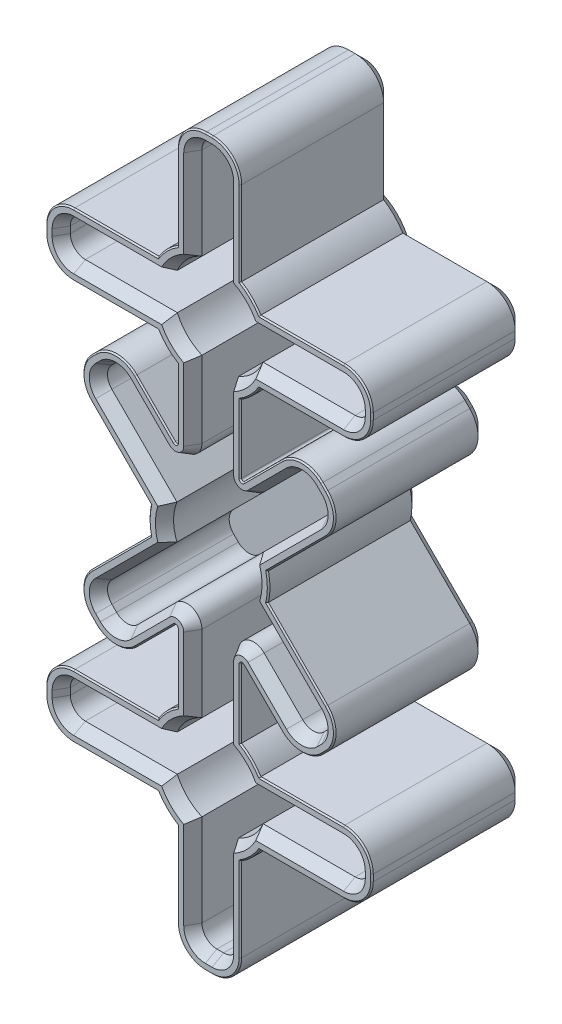
from build123d import *

# Parameters (mm, degrees)
WALLS_DEPTH       = 20
TOP_START         = -3
TOP_PLATE_DEPTH   = 3
CHAMFER1_SIZE     = 1.5
INSERT_CHAM_SIZE  = 1
INSERT_CHAM_SIZE2 = 1.732050808
DEBURS_SIZE       = 0.2


with BuildPart() as part:
    # Sketch5 → Walls (new body)
    with BuildSketch(Plane.XY):
        with BuildLine():
            Line((4.75, 37.644442426), (4.75, 50.25))
            ThreePointArc((4.75, 50.25), (3.50520382, 53.25520382), (0.5, 54.5))
            Line((0.5, 54.5), (-0.5, 54.5))
            ThreePointArc((-0.5, 54.5), (-3.50520382, 53.25520382), (-4.75, 50.25))
            Line((-4.75, 50.25), (-4.75, 37.644442426))
            ThreePointArc((-4.75, 37.644442426), (-6.363961031, 36.363961031), (-7.644442426, 34.75))
            Line((-7.644442426, 34.75), (-20.25, 34.75))
            ThreePointArc((-20.25, 34.75), (-23.25520382, 33.50520382), (-24.5, 30.5))
            Line((-24.5, 30.5), (-24.5, 29.5))
            ThreePointArc((-24.5, 29.5), (-23.25520382, 26.49479618), (-20.25, 25.25))
            Line((-20.25, 25.25), (-7.644442426, 25.25))
            ThreePointArc((-7.644442426, 25.25), (-6.363961031, 23.636038969), (-4.75, 22.355557574))
            Line((-4.75, 22.355557574), (-4.75, 12.071067812))
            ThreePointArc((-4.75, 12.071067812), (-4.904329142, 11.840097929), (-5.176776695, 11.894291117))
            Line((-5.176776695, 11.894291117), (-10.960155108, 17.67766953))
            ThreePointArc((-10.960155108, 17.67766953), (-13.965358928, 18.92246571), (-16.970562748, 17.67766953))
            Line((-16.970562748, 17.67766953), (-17.67766953, 16.970562748))
            ThreePointArc((-17.67766953, 16.970562748), (-18.92246571, 13.965358928), (-17.67766953, 10.960155108))
            Line((-17.67766953, 10.960155108), (-8.764194288, 2.046679867))
            ThreePointArc((-8.764194288, 2.046679867), (-9, 0), (-8.764194288, -2.046679867))
            Line((-8.764194288, -2.046679867), (-17.67766953, -10.960155108))
            ThreePointArc((-17.67766953, -10.960155108), (-18.92246571, -13.965358928), (-17.67766953, -16.970562748))
            Line((-17.67766953, -16.970562748), (-16.970562748, -17.67766953))
            ThreePointArc((-16.970562748, -17.67766953), (-13.965358928, -18.92246571), (-10.960155108, -17.67766953))
            Line((-10.960155108, -17.67766953), (-5.176776695, -11.894291117))
            ThreePointArc((-5.176776695, -11.894291117), (-4.904329142, -11.840097929), (-4.75, -12.071067812))
            Line((-4.75, -12.071067812), (-4.75, -22.355557574))
            ThreePointArc((-4.75, -22.355557574), (-6.363961031, -23.636038969), (-7.644442426, -25.25))
            Line((-7.644442426, -25.25), (-20.25, -25.25))
            ThreePointArc((-20.25, -25.25), (-23.25520382, -26.49479618), (-24.5, -29.5))
            Line((-24.5, -29.5), (-24.5, -30.5))
            ThreePointArc((-24.5, -30.5), (-23.25520382, -33.50520382), (-20.25, -34.75))
            Line((-20.25, -34.75), (-7.644442426, -34.75))
            ThreePointArc((-7.644442426, -34.75), (-6.363961031, -36.363961031), (-4.75, -37.644442426))
            Line((-4.75, -37.644442426), (-4.75, -50.25))
            ThreePointArc((-4.75, -50.25), (-3.50520382, -53.25520382), (-0.5, -54.5))
            Line((-0.5, -54.5), (0.5, -54.5))
            ThreePointArc((0.5, -54.5), (3.50520382, -53.25520382), (4.75, -50.25))
            Line((4.75, -50.25), (4.75, -37.644442426))
            ThreePointArc((4.75, -37.644442426), (6.363961031, -36.363961031), (7.644442426, -34.75))
            Line((7.644442426, -34.75), (20.25, -34.75))
            ThreePointArc((20.25, -34.75), (23.25520382, -33.50520382), (24.5, -30.5))
            Line((24.5, -30.5), (24.5, -29.5))
            ThreePointArc((24.5, -29.5), (23.25520382, -26.49479618), (20.25, -25.25))
            Line((20.25, -25.25), (7.644442426, -25.25))
            ThreePointArc((7.644442426, -25.25), (6.363961031, -23.636038969), (4.75, -22.355557574))
            Line((4.75, -22.355557574), (4.75, -12.071067812))
            ThreePointArc((4.75, -12.071067812), (4.904329142, -11.840097929), (5.176776695, -11.894291117))
            Line((5.176776695, -11.894291117), (10.960155108, -17.67766953))
            ThreePointArc((10.960155108, -17.67766953), (13.965358928, -18.92246571), (16.970562748, -17.67766953))
            Line((16.970562748, -17.67766953), (17.67766953, -16.970562748))
            ThreePointArc((17.67766953, -16.970562748), (18.92246571, -13.965358928), (17.67766953, -10.960155108))
            Line((17.67766953, -10.960155108), (8.764194288, -2.046679867))
            ThreePointArc((8.764194288, -2.046679867), (9, 0), (8.764194288, 2.046679867))
            Line((8.764194288, 2.046679867), (17.67766953, 10.960155108))
            ThreePointArc((17.67766953, 10.960155108), (18.92246571, 13.965358928), (17.67766953, 16.970562748))
            Line((17.67766953, 16.970562748), (16.970562748, 17.67766953))
            ThreePointArc((16.970562748, 17.67766953), (13.965358928, 18.92246571), (10.960155108, 17.67766953))
            Line((10.960155108, 17.67766953), (5.176776695, 11.894291117))
            ThreePointArc((5.176776695, 11.894291117), (4.904329142, 11.840097929), (4.75, 12.071067812))
            Line((4.75, 12.071067812), (4.75, 22.355557574))
            ThreePointArc((4.75, 22.355557574), (6.363961031, 23.636038969), (7.644442426, 25.25))
            Line((7.644442426, 25.25), (20.25, 25.25))
            ThreePointArc((20.25, 25.25), (23.25520382, 26.49479618), (24.5, 29.5))
            Line((24.5, 29.5), (24.5, 30.5))
            ThreePointArc((24.5, 30.5), (23.25520382, 33.50520382), (20.25, 34.75))
            Line((20.25, 34.75), (7.644442426, 34.75))
            ThreePointArc((7.644442426, 34.75), (6.363961031, 36.363961031), (4.75, 37.644442426))
        make_face()
        with BuildLine():
            Line((2.75, 36.437196595), (2.75, 50.25))
            ThreePointArc((2.75, 50.25), (2.090990258, 51.840990258), (0.5, 52.5))
            Line((0.5, 52.5), (-0.5, 52.5))
            ThreePointArc((-0.5, 52.5), (-2.090990258, 51.840990258), (-2.75, 50.25))
            Line((-2.75, 50.25), (-2.75, 36.437196595))
            ThreePointArc((-2.75, 36.437196595), (-4.949747468, 34.949747468), (-6.437196595, 32.75))
            Line((-6.437196595, 32.75), (-20.25, 32.75))
            ThreePointArc((-20.25, 32.75), (-21.840990258, 32.090990258), (-22.5, 30.5))
            Line((-22.5, 30.5), (-22.5, 29.5))
            ThreePointArc((-22.5, 29.5), (-21.840990258, 27.909009742), (-20.25, 27.25))
            Line((-20.25, 27.25), (-6.437196595, 27.25))
            ThreePointArc((-6.437196595, 27.25), (-4.949747468, 25.050252532), (-2.75, 23.562803405))
            Line((-2.75, 23.562803405), (-2.75, 12.071067812))
            ThreePointArc((-2.75, 12.071067812), (-4.138962277, 9.992338864), (-6.590990258, 10.480077554))
            Line((-6.590990258, 10.480077554), (-12.374368671, 16.263455967))
            ThreePointArc((-12.374368671, 16.263455967), (-13.965358928, 16.92246571), (-15.556349186, 16.263455967))
            Line((-15.556349186, 16.263455967), (-16.263455967, 15.556349186))
            ThreePointArc((-16.263455967, 15.556349186), (-16.92246571, 13.965358928), (-16.263455967, 12.374368671))
            Line((-16.263455967, 12.374368671), (-6.496329012, 2.607241716))
            ThreePointArc((-6.496329012, 2.607241716), (-7, 0), (-6.496329012, -2.607241716))
            Line((-6.496329012, -2.607241716), (-16.263455967, -12.374368671))
            ThreePointArc((-16.263455967, -12.374368671), (-16.92246571, -13.965358928), (-16.263455967, -15.556349186))
            Line((-16.263455967, -15.556349186), (-15.556349186, -16.263455967))
            ThreePointArc((-15.556349186, -16.263455967), (-13.965358928, -16.92246571), (-12.374368671, -16.263455967))
            Line((-12.374368671, -16.263455967), (-6.590990258, -10.480077554))
            ThreePointArc((-6.590990258, -10.480077554), (-4.138962277, -9.992338864), (-2.75, -12.071067812))
            Line((-2.75, -12.071067812), (-2.75, -23.562803405))
            ThreePointArc((-2.75, -23.562803405), (-4.949747468, -25.050252532), (-6.437196595, -27.25))
            Line((-6.437196595, -27.25), (-20.25, -27.25))
            ThreePointArc((-20.25, -27.25), (-21.840990258, -27.909009742), (-22.5, -29.5))
            Line((-22.5, -29.5), (-22.5, -30.5))
            ThreePointArc((-22.5, -30.5), (-21.840990258, -32.090990258), (-20.25, -32.75))
            Line((-20.25, -32.75), (-6.437196595, -32.75))
            ThreePointArc((-6.437196595, -32.75), (-4.949747468, -34.949747468), (-2.75, -36.437196595))
            Line((-2.75, -36.437196595), (-2.75, -50.25))
            ThreePointArc((-2.75, -50.25), (-2.090990258, -51.840990258), (-0.5, -52.5))
            Line((-0.5, -52.5), (0.5, -52.5))
            ThreePointArc((0.5, -52.5), (2.090990258, -51.840990258), (2.75, -50.25))
            Line((2.75, -50.25), (2.75, -36.437196595))
            ThreePointArc((2.75, -36.437196595), (4.949747468, -34.949747468), (6.437196595, -32.75))
            Line((6.437196595, -32.75), (20.25, -32.75))
            ThreePointArc((20.25, -32.75), (21.840990258, -32.090990258), (22.5, -30.5))
            Line((22.5, -30.5), (22.5, -29.5))
            ThreePointArc((22.5, -29.5), (21.840990258, -27.909009742), (20.25, -27.25))
            Line((20.25, -27.25), (6.437196595, -27.25))
            ThreePointArc((6.437196595, -27.25), (4.949747468, -25.050252532), (2.75, -23.562803405))
            Line((2.75, -23.562803405), (2.75, -12.071067812))
            ThreePointArc((2.75, -12.071067812), (4.138962277, -9.992338864), (6.590990258, -10.480077554))
            Line((6.590990258, -10.480077554), (12.374368671, -16.263455967))
            ThreePointArc((12.374368671, -16.263455967), (13.965358928, -16.92246571), (15.556349186, -16.263455967))
            Line((15.556349186, -16.263455967), (16.263455967, -15.556349186))
            ThreePointArc((16.263455967, -15.556349186), (16.92246571, -13.965358928), (16.263455967, -12.374368671))
            Line((16.263455967, -12.374368671), (6.496329012, -2.607241716))
            ThreePointArc((6.496329012, -2.607241716), (7, 0), (6.496329012, 2.607241716))
            Line((6.496329012, 2.607241716), (16.263455967, 12.374368671))
            ThreePointArc((16.263455967, 12.374368671), (16.92246571, 13.965358928), (16.263455967, 15.556349186))
            Line((16.263455967, 15.556349186), (15.556349186, 16.263455967))
            ThreePointArc((15.556349186, 16.263455967), (13.965358928, 16.92246571), (12.374368671, 16.263455967))
            Line((12.374368671, 16.263455967), (6.590990258, 10.480077554))
            ThreePointArc((6.590990258, 10.480077554), (4.138962277, 9.992338864), (2.75, 12.071067812))
            Line((2.75, 12.071067812), (2.75, 23.562803405))
            ThreePointArc((2.75, 23.562803405), (4.949747468, 25.050252532), (6.437196595, 27.25))
            Line((6.437196595, 27.25), (20.25, 27.25))
            ThreePointArc((20.25, 27.25), (21.840990258, 27.909009742), (22.5, 29.5))
            Line((22.5, 29.5), (22.5, 30.5))
            ThreePointArc((22.5, 30.5), (21.840990258, 32.090990258), (20.25, 32.75))
            Line((20.25, 32.75), (6.437196595, 32.75))
            ThreePointArc((6.437196595, 32.75), (4.949747468, 34.949747468), (2.75, 36.437196595))
        make_face(mode=Mode.SUBTRACT)
    extrude(amount=WALLS_DEPTH)

    # Sketch6 → Top Plate (add)
    with BuildSketch(Plane.XY.offset(TOP_START)):
        with BuildLine():
            Line((8.764194288, 2.046679867), (17.67766953, 10.960155108))
            ThreePointArc((17.67766953, 10.960155108), (18.92246571, 13.965358928), (17.67766953, 16.970562748))
            Line((17.67766953, 16.970562748), (16.970562748, 17.67766953))
            ThreePointArc((16.970562748, 17.67766953), (13.965358928, 18.92246571), (10.960155108, 17.67766953))
            Line((10.960155108, 17.67766953), (5.176776695, 11.894291117))
            ThreePointArc((5.176776695, 11.894291117), (4.904329142, 11.840097929), (4.75, 12.071067812))
            Line((4.75, 12.071067812), (4.75, 22.355557574))
            ThreePointArc((4.75, 22.355557574), (6.363961031, 23.636038969), (7.644442426, 25.25))
            Line((7.644442426, 25.25), (20.25, 25.25))
            ThreePointArc((20.25, 25.25), (23.25520382, 26.49479618), (24.5, 29.5))
            Line((24.5, 29.5), (24.5, 30.5))
            ThreePointArc((24.5, 30.5), (23.25520382, 33.50520382), (20.25, 34.75))
            Line((20.25, 34.75), (7.644442426, 34.75))
            ThreePointArc((7.644442426, 34.75), (6.363961031, 36.363961031), (4.75, 37.644442426))
            Line((4.75, 37.644442426), (4.75, 50.25))
            ThreePointArc((4.75, 50.25), (3.50520382, 53.25520382), (0.5, 54.5))
            Line((0.5, 54.5), (-0.5, 54.5))
            ThreePointArc((-0.5, 54.5), (-3.50520382, 53.25520382), (-4.75, 50.25))
            Line((-4.75, 50.25), (-4.75, 37.644442426))
            ThreePointArc((-4.75, 37.644442426), (-6.363961031, 36.363961031), (-7.644442426, 34.75))
            Line((-7.644442426, 34.75), (-20.25, 34.75))
            ThreePointArc((-20.25, 34.75), (-23.25520382, 33.50520382), (-24.5, 30.5))
            Line((-24.5, 30.5), (-24.5, 29.5))
            ThreePointArc((-24.5, 29.5), (-23.25520382, 26.49479618), (-20.25, 25.25))
            Line((-20.25, 25.25), (-7.644442426, 25.25))
            ThreePointArc((-7.644442426, 25.25), (-6.363961031, 23.636038969), (-4.75, 22.355557574))
            Line((-4.75, 22.355557574), (-4.75, 12.071067812))
            ThreePointArc((-4.75, 12.071067812), (-4.904329142, 11.840097929), (-5.176776695, 11.894291117))
            Line((-5.176776695, 11.894291117), (-10.960155108, 17.67766953))
            ThreePointArc((-10.960155108, 17.67766953), (-13.965358928, 18.92246571), (-16.970562748, 17.67766953))
            Line((-16.970562748, 17.67766953), (-17.67766953, 16.970562748))
            ThreePointArc((-17.67766953, 16.970562748), (-18.92246571, 13.965358928), (-17.67766953, 10.960155108))
            Line((-17.67766953, 10.960155108), (-8.764194288, 2.046679867))
            ThreePointArc((-8.764194288, 2.046679867), (-9, 0), (-8.764194288, -2.046679867))
            Line((-8.764194288, -2.046679867), (-17.67766953, -10.960155108))
            ThreePointArc((-17.67766953, -10.960155108), (-18.92246571, -13.965358928), (-17.67766953, -16.970562748))
            Line((-17.67766953, -16.970562748), (-16.970562748, -17.67766953))
            ThreePointArc((-16.970562748, -17.67766953), (-13.965358928, -18.92246571), (-10.960155108, -17.67766953))
            Line((-10.960155108, -17.67766953), (-5.176776695, -11.894291117))
            ThreePointArc((-5.176776695, -11.894291117), (-4.904329142, -11.840097929), (-4.75, -12.071067812))
            Line((-4.75, -12.071067812), (-4.75, -22.355557574))
            ThreePointArc((-4.75, -22.355557574), (-6.363961031, -23.636038969), (-7.644442426, -25.25))
            Line((-7.644442426, -25.25), (-20.25, -25.25))
            ThreePointArc((-20.25, -25.25), (-23.25520382, -26.49479618), (-24.5, -29.5))
            Line((-24.5, -29.5), (-24.5, -30.5))
            ThreePointArc((-24.5, -30.5), (-23.25520382, -33.50520382), (-20.25, -34.75))
            Line((-20.25, -34.75), (-7.644442426, -34.75))
            ThreePointArc((-7.644442426, -34.75), (-6.363961031, -36.363961031), (-4.75, -37.644442426))
            Line((-4.75, -37.644442426), (-4.75, -50.25))
            ThreePointArc((-4.75, -50.25), (-3.50520382, -53.25520382), (-0.5, -54.5))
            Line((-0.5, -54.5), (0.5, -54.5))
            ThreePointArc((0.5, -54.5), (3.50520382, -53.25520382), (4.75, -50.25))
            Line((4.75, -50.25), (4.75, -37.644442426))
            ThreePointArc((4.75, -37.644442426), (6.363961031, -36.363961031), (7.644442426, -34.75))
            Line((7.644442426, -34.75), (20.25, -34.75))
            ThreePointArc((20.25, -34.75), (23.25520382, -33.50520382), (24.5, -30.5))
            Line((24.5, -30.5), (24.5, -29.5))
            ThreePointArc((24.5, -29.5), (23.25520382, -26.49479618), (20.25, -25.25))
            Line((20.25, -25.25), (7.644442426, -25.25))
            ThreePointArc((7.644442426, -25.25), (6.363961031, -23.636038969), (4.75, -22.355557574))
            Line((4.75, -22.355557574), (4.75, -12.071067812))
            ThreePointArc((4.75, -12.071067812), (4.904329142, -11.840097929), (5.176776695, -11.894291117))
            Line((5.176776695, -11.894291117), (10.960155108, -17.67766953))
            ThreePointArc((10.960155108, -17.67766953), (13.965358928, -18.92246571), (16.970562748, -17.67766953))
            Line((16.970562748, -17.67766953), (17.67766953, -16.970562748))
            ThreePointArc((17.67766953, -16.970562748), (18.92246571, -13.965358928), (17.67766953, -10.960155108))
            Line((17.67766953, -10.960155108), (8.764194288, -2.046679867))
            ThreePointArc((8.764194288, -2.046679867), (9, 0), (8.764194288, 2.046679867))
        make_face()
    extrude(amount=TOP_PLATE_DEPTH)

    # Chamfer1
    chamfer1_edges = [part.edges().sort_by_distance(p)[0] for p in [
        (13.220931909, 6.503417488, -3),
        (18.92246571, 13.965358928, -3),
        (17.324116139, 17.324116139, -3),
        (13.965358928, 18.92246571, -3),
        (8.068465902, 14.785980323, -3),
        (4.904329142, 11.840097929, -3),
        (4.75, 17.213312693, -3),
        (6.363961031, 23.636038969, -3),
        (13.947221213, 25.25, -3),
        (23.25520382, 26.49479618, -3),
        (24.5, 30, -3),
        (23.25520382, 33.50520382, -3),
        (13.947221213, 34.75, -3),
        (6.363961031, 36.363961031, -3),
        (4.75, 43.947221213, -3),
        (3.50520382, 53.25520382, -3),
        (0, 54.5, -3),
        (-3.50520382, 53.25520382, -3),
        (-4.75, 43.947221213, -3),
        (-6.363961031, 36.363961031, -3),
        (-13.947221213, 34.75, -3),
        (-23.25520382, 33.50520382, -3),
        (-24.5, 30, -3),
        (-23.25520382, 26.49479618, -3),
        (-13.947221213, 25.25, -3),
        (-6.363961031, 23.636038969, -3),
        (-4.75, 17.213312693, -3),
        (-4.904329142, 11.840097929, -3),
        (-8.068465902, 14.785980323, -3),
        (-13.965358928, 18.92246571, -3),
        (-17.324116139, 17.324116139, -3),
        (-18.92246571, 13.965358928, -3),
        (-13.220931909, 6.503417488, -3),
        (-9, 0, -3),
        (-13.220931909, -6.503417488, -3),
        (-18.92246571, -13.965358928, -3),
        (-17.324116139, -17.324116139, -3),
        (-13.965358928, -18.92246571, -3),
        (-8.068465902, -14.785980323, -3),
        (-4.904329142, -11.840097929, -3),
        (-4.75, -17.213312693, -3),
        (-6.363961031, -23.636038969, -3),
        (-13.947221213, -25.25, -3),
        (-23.25520382, -26.49479618, -3),
        (-24.5, -30, -3),
        (-23.25520382, -33.50520382, -3),
        (-13.947221213, -34.75, -3),
        (-6.363961031, -36.363961031, -3),
        (-4.75, -43.947221213, -3),
        (-3.50520382, -53.25520382, -3),
        (0, -54.5, -3),
        (3.50520382, -53.25520382, -3),
        (4.75, -43.947221213, -3),
        (6.363961031, -36.363961031, -3),
        (13.947221213, -34.75, -3),
        (23.25520382, -33.50520382, -3),
        (24.5, -30, -3),
        (23.25520382, -26.49479618, -3),
        (13.947221213, -25.25, -3),
        (6.363961031, -23.636038969, -3),
        (4.75, -17.213312693, -3),
        (4.904329142, -11.840097929, -3),
        (8.068465902, -14.785980323, -3),
        (13.965358928, -18.92246571, -3),
        (17.324116139, -17.324116139, -3),
        (18.92246571, -13.965358928, -3),
        (13.220931909, -6.503417488, -3),
        (9, 0, -3),
    ]]
    chamfer(chamfer1_edges, length=CHAMFER1_SIZE)

    # Insert Cham
    insert_cham_edges = [part.edges().sort_by_distance(p)[0] for p in [
        (2.090990258, 51.840990258, 20),
        (0, 52.5, 20),
        (-2.090990258, 51.840990258, 20),
        (-2.75, 43.343598297, 20),
        (-4.949747468, 34.949747468, 20),
        (-13.343598297, 32.75, 20),
        (-21.840990258, 32.090990258, 20),
        (-22.5, 30, 20),
        (-21.840990258, 27.909009742, 20),
        (-13.343598297, 27.25, 20),
        (-4.949747468, 25.050252532, 20),
        (-2.75, 17.816935609, 20),
        (-4.138962277, 9.992338864, 20),
        (-9.482679464, 13.371766761, 20),
        (-13.965358928, 16.92246571, 20),
        (-15.909902577, 15.909902577, 20),
        (-16.92246571, 13.965358928, 20),
        (-11.37989249, 7.490805193, 20),
        (-7, 0, 20),
        (-11.37989249, -7.490805193, 20),
        (-16.92246571, -13.965358928, 20),
        (-15.909902577, -15.909902577, 20),
        (-13.965358928, -16.92246571, 20),
        (-9.482679464, -13.371766761, 20),
        (-4.138962277, -9.992338864, 20),
        (-2.75, -17.816935609, 20),
        (-4.949747468, -25.050252532, 20),
        (-13.343598297, -27.25, 20),
        (-21.840990258, -27.909009742, 20),
        (-22.5, -30, 20),
        (-21.840990258, -32.090990258, 20),
        (-13.343598297, -32.75, 20),
        (-4.949747468, -34.949747468, 20),
        (-2.75, -43.343598297, 20),
        (-2.090990258, -51.840990258, 20),
        (0, -52.5, 20),
        (2.090990258, -51.840990258, 20),
        (2.75, -43.343598297, 20),
        (4.949747468, -34.949747468, 20),
        (13.343598297, -32.75, 20),
        (21.840990258, -32.090990258, 20),
        (22.5, -30, 20),
        (21.840990258, -27.909009742, 20),
        (13.343598297, -27.25, 20),
        (4.949747468, -25.050252532, 20),
        (2.75, -17.816935609, 20),
        (4.138962277, -9.992338864, 20),
        (9.482679464, -13.371766761, 20),
        (13.965358928, -16.92246571, 20),
        (15.909902577, -15.909902577, 20),
        (16.92246571, -13.965358928, 20),
        (11.37989249, -7.490805193, 20),
        (7, 0, 20),
        (11.37989249, 7.490805193, 20),
        (16.92246571, 13.965358928, 20),
        (15.909902577, 15.909902577, 20),
        (13.965358928, 16.92246571, 20),
        (9.482679464, 13.371766761, 20),
        (4.138962277, 9.992338864, 20),
        (2.75, 17.816935609, 20),
        (4.949747468, 25.050252532, 20),
        (13.343598297, 27.25, 20),
        (21.840990258, 27.909009742, 20),
        (22.5, 30, 20),
        (21.840990258, 32.090990258, 20),
        (13.343598297, 32.75, 20),
        (4.949747468, 34.949747468, 20),
        (2.75, 43.343598297, 20),
    ]]
    insert_cham_side = [part.faces().sort_by_distance(p)[0] for p in [
        (22.410159443, 32.660159443, 20),
    ]]
    chamfer(insert_cham_edges, length=INSERT_CHAM_SIZE, length2=INSERT_CHAM_SIZE2, reference=insert_cham_side[0])

    # Deburs
    deburs_edges = [part.edges().sort_by_distance(p)[0] for p in [
        (13.947221213, 34.75, 20),
        (23.25520382, 33.50520382, 20),
        (24.5, 30, 20),
        (23.25520382, 26.49479618, 20),
        (13.947221213, 25.25, 20),
        (6.363961031, 23.636038969, 20),
        (4.75, 17.213312693, 20),
        (4.904329142, 11.840097929, 20),
        (8.068465902, 14.785980323, 20),
        (13.965358928, 18.92246571, 20),
        (17.324116139, 17.324116139, 20),
        (18.92246571, 13.965358928, 20),
        (13.220931909, 6.503417488, 20),
        (9, 0, 20),
        (13.220931909, -6.503417488, 20),
        (18.92246571, -13.965358928, 20),
        (17.324116139, -17.324116139, 20),
        (13.965358928, -18.92246571, 20),
        (8.068465902, -14.785980323, 20),
        (4.904329142, -11.840097929, 20),
        (4.75, -17.213312693, 20),
        (6.363961031, -23.636038969, 20),
        (13.947221213, -25.25, 20),
        (23.25520382, -26.49479618, 20),
        (24.5, -30, 20),
        (23.25520382, -33.50520382, 20),
        (13.947221213, -34.75, 20),
        (6.363961031, -36.363961031, 20),
        (4.75, -43.947221213, 20),
        (3.50520382, -53.25520382, 20),
        (0, -54.5, 20),
        (-3.50520382, -53.25520382, 20),
        (-4.75, -43.947221213, 20),
        (-6.363961031, -36.363961031, 20),
        (-13.947221213, -34.75, 20),
        (-23.25520382, -33.50520382, 20),
        (-24.5, -30, 20),
        (-23.25520382, -26.49479618, 20),
        (-13.947221213, -25.25, 20),
        (-6.363961031, -23.636038969, 20),
        (-4.75, -17.213312693, 20),
        (-4.904329142, -11.840097929, 20),
        (-8.068465902, -14.785980323, 20),
        (-13.965358928, -18.92246571, 20),
        (-17.324116139, -17.324116139, 20),
        (-18.92246571, -13.965358928, 20),
        (-13.220931909, -6.503417488, 20),
        (-9, 0, 20),
        (-13.220931909, 6.503417488, 20),
        (-18.92246571, 13.965358928, 20),
        (-17.324116139, 17.324116139, 20),
        (-13.965358928, 18.92246571, 20),
        (-8.068465902, 14.785980323, 20),
        (-4.904329142, 11.840097929, 20),
        (-4.75, 17.213312693, 20),
        (-6.363961031, 23.636038969, 20),
        (-13.947221213, 25.25, 20),
        (-23.25520382, 26.49479618, 20),
        (-24.5, 30, 20),
        (-23.25520382, 33.50520382, 20),
        (-13.947221213, 34.75, 20),
        (-6.363961031, 36.363961031, 20),
        (-4.75, 43.947221213, 20),
        (-3.50520382, 53.25520382, 20),
        (0, 54.5, 20),
        (3.50520382, 53.25520382, 20),
        (4.75, 43.947221213, 20),
        (6.363961031, 36.363961031, 20),
    ]]
    chamfer(deburs_edges, length=DEBURS_SIZE)


solid = part.part
